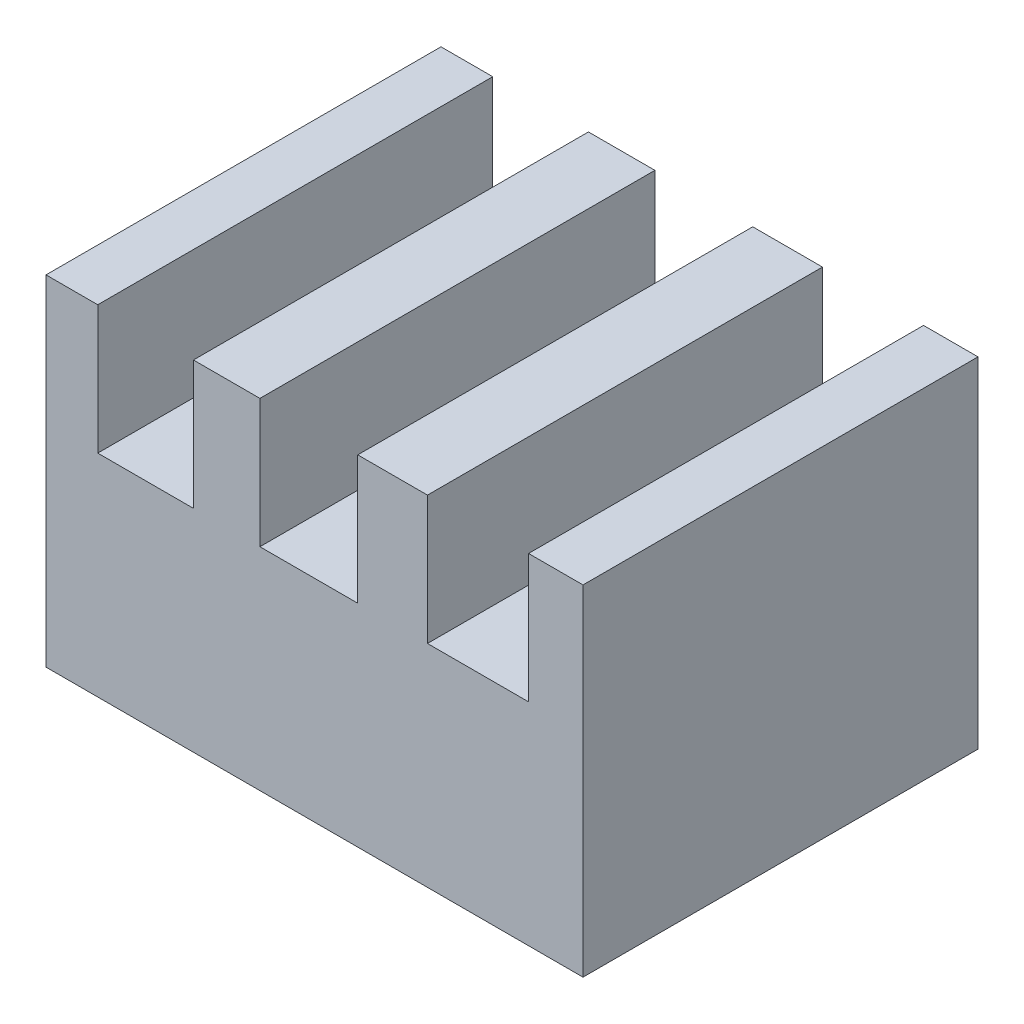
from build123d import *

# Parameters (mm, degrees)
SKETCH_1_W          = 52.162890579
SKETCH_1_H          = 38.368703959
EXTRUDE_1_DEPTH     = 33
SKETCH_2_W          = 9.293281352
SKETCH_2_H          = 12.481057266
SKETCH_2_W_2        = 9.503299011
SKETCH_2_W_3        = 9.818325497
CUT_EXTRUDE_1_DEPTH = 43


with BuildPart() as part:
    # ｽｹｯﾁ1 → ﾎﾞｽ - 押し出し1 (new body)
    with BuildSketch(Plane(origin=(0, 0, 0), x_dir=(1, 0, 0), z_dir=(0, 1, 0))):
        with Locations((27.472455704, 19.18435198)):
            Rectangle(SKETCH_1_W, SKETCH_1_H)
    extrude(amount=EXTRUDE_1_DEPTH)

    # ｽｹｯﾁ2 → ｶｯﾄ - 押し出し1 (cut)
    with BuildSketch(Plane.XY):
        with Locations((11.064826198, 26.759471367)):
            Rectangle(SKETCH_2_W, SKETCH_2_H)
        with Locations((26.921159354, 26.759471367)):
            Rectangle(SKETCH_2_W_2, SKETCH_2_H)
        with Locations((43.355041068, 26.759471367)):
            Rectangle(SKETCH_2_W_3, SKETCH_2_H)
    extrude(amount=-CUT_EXTRUDE_1_DEPTH, mode=Mode.SUBTRACT)


solid = part.part
